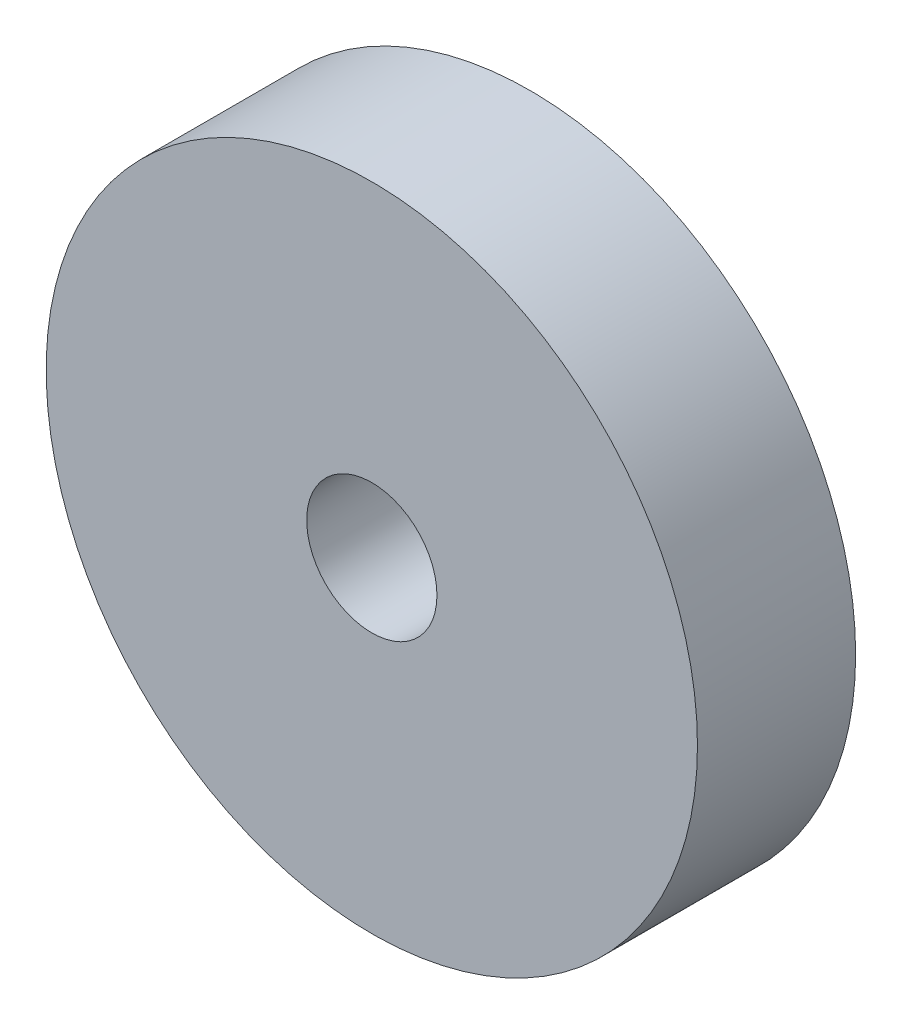
from build123d import *

# Parameters (mm, degrees)
SKETCH1_R           = 18
BOSS_EXTRUDE1_DEPTH = 20
SKETCH2_R           = 7
CUT_EXTRUDE1_DEPTH  = 60
SKETCH4_R           = 35
SKETCH4_R_2         = 14.576002813
BOSS_EXTRUDE2_DEPTH = 17


with BuildPart() as part:
    # Sketch1 → Boss-Extrude1 (new body)
    with BuildSketch(Plane.XY):
        Circle(SKETCH1_R)
    extrude(amount=BOSS_EXTRUDE1_DEPTH)

    # Sketch2 → Cut-Extrude1 (cut)
    with BuildSketch(Plane.XY.offset(20)):
        Circle(SKETCH2_R)
    extrude(amount=-CUT_EXTRUDE1_DEPTH, mode=Mode.SUBTRACT)

    # Sketch4 → Boss-Extrude2 (add)
    with BuildSketch(Plane.XY.offset(20)):
        Circle(SKETCH4_R)
        Circle(SKETCH4_R_2, mode=Mode.SUBTRACT)
    extrude(amount=-BOSS_EXTRUDE2_DEPTH)


solid = part.part
